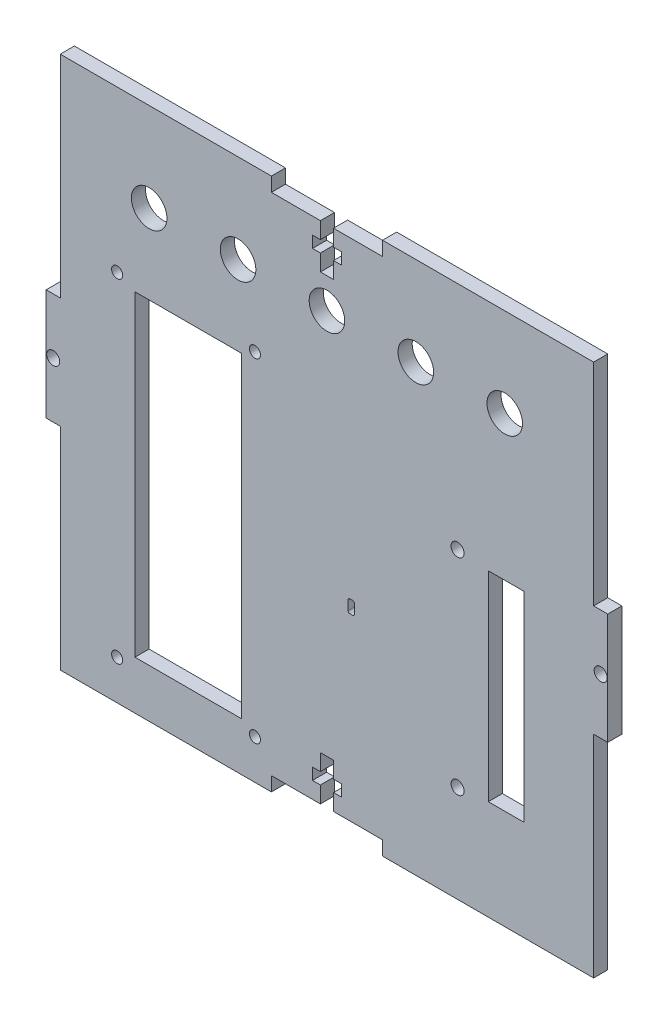
from build123d import *

# Parameters (mm, degrees)
SKETCH1_R           = 1.47
BOSS_EXTRUDE1_DEPTH = 1.5875
SKETCH3_W           = 8
SKETCH3_H           = 45
CUT_EXTRUDE1_DEPTH  = 88.184638842
SKETCH4_W           = 24
SKETCH4_H           = 71.2
CUT_EXTRUDE2_DEPTH  = 88.184638842
CUT_EXTRUDE4_DEPTH  = 88.184638842
SKETCH6_R           = 4
CUT_EXTRUDE5_DEPTH  = 88.184638842
SKETCH9_R           = 1.25
SKETCH9_R_2         = 1.47
CUT_EXTRUDE6_DEPTH  = 88.184638842


with BuildPart() as part:
    # Sketch1 → Boss-Extrude1 (new, symmetric)
    with BuildSketch(Plane.XY):
        Polygon((-12.5, 60), (-60, 60), (-60, 12.5), (-63.175, 12.5), (-63.175, -12.5), (-60, -12.5), (-60, -60), (-12.5, -60), (-12.5, -56.825), (-1.47, -56.825), (-1.47, -53.125), (-3.25, -53.125), (-3.25, -50.525), (-1.47, -50.525), (-1.47, -46.825), (1.47, -46.825), (1.47, -50.525), (3.25, -50.525), (3.25, -53.125), (1.47, -53.125), (1.47, -56.825), (12.5, -56.825), (12.5, -60), (60, -60), (60, -12.5), (63.175, -12.5), (63.175, 12.5), (60, 12.5), (60, 60), (12.5, 60), (12.5, 56.825), (1.47, 56.825), (1.47, 53.125), (3.25, 53.125), (3.25, 50.525), (1.47, 50.525), (1.47, 46.825), (-1.47, 46.825), (-1.47, 50.525), (-3.25, 50.525), (-3.25, 53.125), (-1.47, 53.125), (-1.47, 56.825), (-12.5, 56.825), align=None)
        with Locations((61.5875, 0)):
            Circle(SKETCH1_R, mode=Mode.SUBTRACT)
        with Locations((-61.5875, 0)):
            Circle(SKETCH1_R, mode=Mode.SUBTRACT)
    extrude(amount=BOSS_EXTRUDE1_DEPTH, both=True)

    # Sketch3 → Cut-Extrude1 (cut, through all)
    with BuildSketch(Plane(origin=(0, 0, -1.5875), x_dir=(-1, 0, 0), z_dir=(0, 0, -1))):
        with Locations((-40.3, -15)):
            Rectangle(SKETCH3_W, SKETCH3_H)
    extrude(amount=-CUT_EXTRUDE1_DEPTH, mode=Mode.SUBTRACT)

    # Sketch4 → Cut-Extrude2 (cut, through all)
    with BuildSketch(Plane(origin=(0, 0, -1.5875), x_dir=(-1, 0, 0), z_dir=(0, 0, -1))):
        with Locations((31.2, -13.494459363)):
            Rectangle(SKETCH4_W, SKETCH4_H)
    extrude(amount=-CUT_EXTRUDE2_DEPTH, mode=Mode.SUBTRACT)

    # Sketch5 → Cut-Extrude4 (cut, through all)
    with BuildSketch(Plane(origin=(0, 0, -1.5875), x_dir=(-1, 0, 0), z_dir=(0, 0, -1))):
        with BuildLine():
            Line((-5.153420736, -16.45), (-5.77915134, -16.45))
            ThreePointArc((-5.77915134, -16.45), (-6.043498683, -16.350200736), (-6.175937675, -16.10060241))
            ThreePointArc((-6.175937675, -16.10060241), (-6.245834875, -15), (-6.175937675, -13.89939759))
            ThreePointArc((-6.175937675, -13.89939759), (-6.043498683, -13.649799264), (-5.77915134, -13.55))
            Line((-5.77915134, -13.55), (-5.153420736, -13.55))
            ThreePointArc((-5.153420736, -13.55), (-4.870578023, -13.667157288), (-4.753420736, -13.95))
            Line((-4.753420736, -13.95), (-4.753420736, -16.05))
            ThreePointArc((-4.753420736, -16.05), (-4.870578023, -16.332842712), (-5.153420736, -16.45))
        make_face()
    extrude(amount=-CUT_EXTRUDE4_DEPTH, mode=Mode.SUBTRACT)

    # Sketch6 → Cut-Extrude5 (cut, through all)
    with BuildSketch(Plane(origin=(0, 0, -1.5875), x_dir=(-1, 0, 0), z_dir=(0, 0, -1))):
        with Locations((40, 40)):
            Circle(SKETCH6_R)
        with Locations((20, 40)):
            Circle(SKETCH6_R)
        with Locations((0, 40)):
            Circle(SKETCH6_R)
        with Locations((-20, 40)):
            Circle(SKETCH6_R)
        with Locations((-40, 40)):
            Circle(SKETCH6_R)
    extrude(amount=-CUT_EXTRUDE5_DEPTH, mode=Mode.SUBTRACT)

    # Sketch9 → Cut-Extrude6 (cut, through all)
    with BuildSketch(Plane.XY.offset(1.5875)):
        with Locations((-47.2, 23.905540637)):
            Circle(SKETCH9_R)
        with Locations((-16.2, 23.905540637)):
            Circle(SKETCH9_R)
        with Locations((-16.2, -51.094459363)):
            Circle(SKETCH9_R)
        with Locations((-47.2, -51.094459363)):
            Circle(SKETCH9_R)
        with Locations((29.3875, 8.16125846)):
            Circle(SKETCH9_R_2)
        with Locations((29.3875, -38.16125846)):
            Circle(SKETCH9_R_2)
    extrude(amount=-CUT_EXTRUDE6_DEPTH, mode=Mode.SUBTRACT)


solid = part.part
